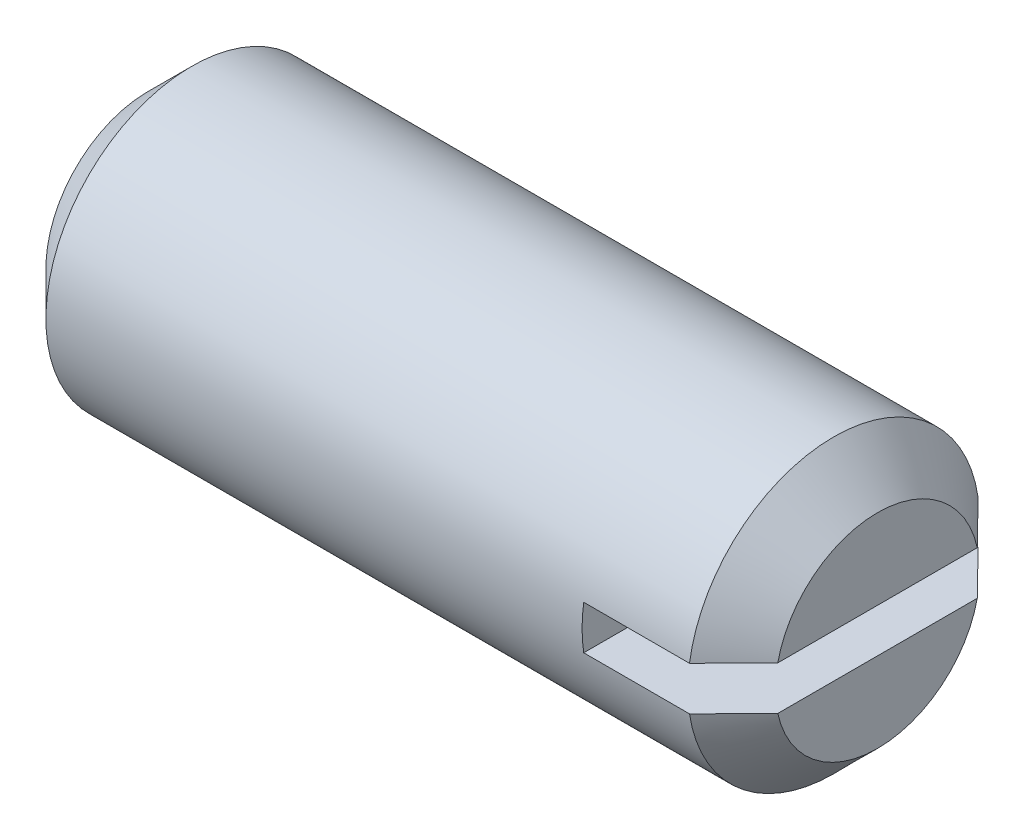
from build123d import *

# Parameters (mm, degrees)
SKETCH1_R          = 2
BODY_DEPTH         = 10
CHAMFER1_SIZE      = 0.6
SPLIT_2_DEPTH      = 12.606086765
SPLIT_2_DEPTH_BACK = 12.606086765
SKETCH2_W          = 0.6
SKETCH2_H          = 2.05


with BuildPart() as part:
    # Sketch1 → Body (new body)
    with BuildSketch(Plane(origin=(0, 0, 0), x_dir=(0, 0, -1), z_dir=(1, 0, 0))):
        Circle(SKETCH1_R)
    extrude(amount=BODY_DEPTH)

    # Chamfer1
    chamfer1_edges = [part.edges().sort_by_distance(p)[0] for p in [
        (10, 0, 2),
        (0, 0, 2),
    ]]
    chamfer(chamfer1_edges, length=CHAMFER1_SIZE)

    # Sketch2 → Split 2 (cut, two sides: drawn at the far end of the back side and taken through both)
    with BuildSketch(Plane(origin=(-1.025, -1.025, 0), x_dir=(0, 1, 0), z_dir=(0, 0, 1)).offset(-SPLIT_2_DEPTH_BACK)):
        with Locations((1.025, -10)):
            Rectangle(SKETCH2_W, SKETCH2_H)
    extrude(amount=SPLIT_2_DEPTH + SPLIT_2_DEPTH_BACK, mode=Mode.SUBTRACT)


solid = part.part
